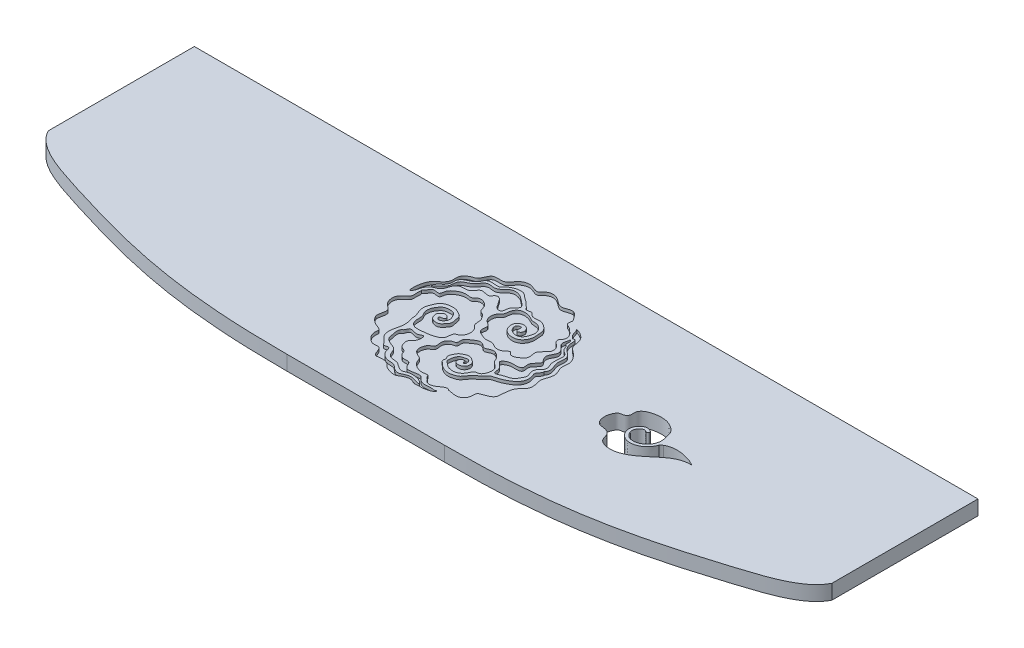
from build123d import *

# Parameters (mm, degrees)
BOSS_EXTRUDE1_DEPTH   = 1
BOSS_EXTRUDE1_2_DEPTH = 1
BOSS_EXTRUDE1_3_DEPTH = 1
BOSS_EXTRUDE3_DEPTH   = 1
SKETCH2_R             = 25.101353652
BOSS_EXTRUDE2_DEPTH   = 1
SKETCH3_W             = 253.62074887
SKETCH3_H             = 71.275896812
BOSS_EXTRUDE4_DEPTH   = 4.75
CUT_EXTRUDE1_DEPTH    = 2
CUT_EXTRUDE2_DEPTH    = 132.808561798
CUT_EXTRUDE3_DEPTH    = 132.808561802


with BuildPart() as part:
    # Sketch1 → Boss-Extrude1 (new body)
    with BuildSketch(Plane(origin=(0, 0, 0), x_dir=(1, 0, 0), z_dir=(0, 1, 0))):
        with BuildLine():
            add(Edge.make_bspline(
                [(-22.657700945, 3.566137127), (-22.563075027, 4.624031382), (-21.761621272, 6.480086653), (-19.815989286, 7.04802782), (-18.412013179, 8.060840455), (-18.29531858, 9.855374146), (-16.704778607, 11.884521762), (-14.192946372, 11.140079806), (-12.988988627, 12.691613103), (-11.8065693, 14.406327549), (-9.309951162, 12.767536509), (-8.561122509, 14.307301198), (-7.639842522, 14.929181339), (-6.425133548, 14.181513411), (-5.99792689, 13.167270669), (-5.292204197, 12.452981418), (-5.003762856, 11.581061251), (-4.160339051, 10.992247421), (-2.599217111, 10.853898339), (-2.823606313, 13.071768576), (-1.84164571, 14.159264117), (-0.300835314, 15.58788963), (-2.358409004, 17.013661093), (-3.54729972, 18.044647147), (-5.11043484, 18.949001762), (-7.005550972, 19.123672766), (-8.311690989, 17.879986895), (-9.139755488, 17.07338369), (-10.850341908, 16.222267664), (-12.506670955, 17.021641787), (-14.082140957, 15.901195549), (-14.784359861, 14.430733392), (-16.473643912, 13.491155241), (-18.562061532, 12.625798306), (-18.240140649, 10.004634904), (-19.468938662, 8.607227898), (-21.969060467, 6.217831732), (-20.994296139, 8.482915912), (-19.81088583, 9.14374692), (-18.776132731, 10.699338648), (-19.150743077, 12.510998979), (-17.845166223, 14.095108924), (-16.078653923, 14.50885238), (-14.747613409, 15.729966598), (-14.310991002, 17.163169976), (-12.414022297, 18.024659863), (-10.234521647, 17.008097584), (-9.161729716, 18.536943989), (-8.373009435, 19.137649982), (-6.811653992, 19.942084445), (-4.612028514, 20.2767563), (-3.050323675, 18.646525233), (-1.821328042, 18.099064143), (-0.845551247, 16.853170761), (0.042044696, 16.40929203), (0.70348453, 15.059368319), (2.324059981, 16.167814906), (3.003374848, 14.910993224), (4.397333383, 14.289763408), (6.042999933, 14.861325487), (8.035231966, 13.937576078), (9.428743803, 12.733786548), (9.566197549, 10.464653929), (9.875836049, 8.299336805), (8.1395515, 5.728763314), (5.21230047, 5.369849711), (2.549287028, 6.880502619), (2.17408454, 10.528779114), (5.696088557, 11.406539936), (6.920434176, 8.814218219), (5.378204065, 7.730338539), (4.618004305, 8.700777916), (5.333751824, 10.026074452), (3.134593539, 9.829991294), (3.650868201, 7.832662657), (4.817518295, 7.015231066), (6.108202813, 6.578080657), (7.680260791, 7.080394364), (8.577052135, 8.862612491), (8.997173262, 10.977740681), (7.819496543, 12.503191913), (6.436418932, 13.486571646), (4.757186283, 13.214678428), (2.758953629, 14.575591149), (-0.123430172, 14.950615786), (-1.752262645, 12.602476003), (-1.453371251, 10.732288423), (-2.595223322, 10.056532198), (-3.447235674, 8.691842845), (-3.324228936, 6.03602782), (-0.30551766, 4.974276746), (-1.43992813, 2.626109568), (-0.056000594, 1.528148997), (1.007248559, 1.140684978), (2.558560273, 0.422947732), (4.333309083, 1.126428553), (6.087211825, -0.201427316), (7.974887536, -0.281964419), (9.011637296, 0.737929227), (9.983521568, 1.548778893), (10.596020706, 0.043366015), (12.424849423, 0.40486745), (13.439834027, 1.384060559), (15.077699591, 2.658386996), (13.530297418, 5.128290278), (15.132677675, 6.171418448), (15.296363849, 7.093264368), (16.728568332, 7.65184914), (16.457226204, 10.45762267), (14.332911, 11.038747233), (14.188661429, 12.68077393), (15.372642439, 13.416147167), (15.160036258, 15.360572862), (13.747142112, 16.515758696), (12.684040371, 17.629731407), (11.000256524, 18.036480651), (11.225471084, 19.3904939), (11.41576675, 19.87092144)],
                knots=[0, 0, 0, 0, 0.017523663, 0.025959482, 0.030717232, 0.043241503, 0.051537727, 0.067078171, 0.074413601, 0.080526409, 0.096702774, 0.100460127, 0.105002245, 0.112222056, 0.118418387, 0.122182452, 0.127503544, 0.131914264, 0.137942063, 0.146241458, 0.157580756, 0.161522541, 0.175435486, 0.18221518, 0.188128997, 0.203154719, 0.206367109, 0.215675327, 0.221113579, 0.234901304, 0.238660912, 0.249814319, 0.258904826, 0.268447313, 0.281308595, 0.29111387, 0.303078437, 0.309290665, 0.31679302, 0.326136458, 0.335142849, 0.343491566, 0.354676175, 0.362589519, 0.370311266, 0.37643044, 0.39254918, 0.398874993, 0.402834307, 0.407904952, 0.426452265, 0.429989996, 0.442259466, 0.446574017, 0.454076462, 0.457325817, 0.467270799, 0.471161081, 0.476863036, 0.48964413, 0.495378404, 0.510439895, 0.514274139, 0.530155592, 0.543256486, 0.557251083, 0.571606522, 0.586907656, 0.600593405, 0.611983518, 0.617798518, 0.621373523, 0.627624131, 0.632962588, 0.642862605, 0.648297653, 0.655747682, 0.662921561, 0.671572105, 0.685355056, 0.693206634, 0.699985268, 0.71072487, 0.716803747, 0.737207518, 0.746134899, 0.757660823, 0.761539365, 0.765368912, 0.782390668, 0.793553782, 0.80456569, 0.811493813, 0.817543754, 0.82254674, 0.837450794, 0.841685931, 0.856013065, 0.860236066, 0.866012492, 0.86937196, 0.88046211, 0.886323346, 0.892551249, 0.909708122, 0.913831035, 0.919826721, 0.922281703, 0.936224996, 0.947414152, 0.95274072, 0.957126005, 0.96704293, 0.976477191, 0.985240841, 0.990903584, 1, 1, 1, 1], degree=3))
            add(Edge.make_bspline(
                [(-15.793989559, 16.808282214), (-15.21735742, 17.741847858), (-14.632636394, 20.457567565), (-10.314773434, 19.034010353), (-8.766307809, 22.640797342), (-5.389132618, 23.786571984), (-2.56862384, 21.701248487), (-1.085845307, 24.103979233), (1.439508916, 24.489742682), (3.402939972, 23.165746713), (5.594640629, 21.315193189), (8.749619612, 23.708591294), (10.529717069, 21.283035319), (11.268876231, 20.085990932), (11.41576675, 19.87092144)],
                knots=[0, 0, 0, 0, 0.019600588, 0.039791796, 0.060359563, 0.080527002, 0.098332478, 0.108628014, 0.124559506, 0.139100524, 0.151814102, 0.172323487, 0.191936306, 0.196615233, 0.196615233, 0.196615233, 0.196615233], degree=3))
            add(Edge.make_bspline(
                [(-22.657700945, 3.566137127), (-22.775935274, 3.312459937), (-23.017483387, 2.744953533), (-24.02184756, 1.011363184), (-23.998440315, 8.453426635), (-20.692978035, 9.212540033), (-19.365563401, 11.852676999), (-20.003375789, 14.247993746), (-17.847267571, 15.92855271), (-16.158523921, 16.25918734), (-15.846528818, 16.723221317), (-15.793989559, 16.808282214)],
                knots=[0.884410347, 0.884410347, 0.884410347, 0.884410347, 0.888045598, 0.891981775, 0.919321247, 0.948755615, 0.956912259, 0.970306583, 0.989857361, 0.998214112, 1, 1, 1, 1], degree=3))
        make_face()
    extrude(amount=BOSS_EXTRUDE1_DEPTH)



with BuildPart() as body_2:
    # Sketch1 → Boss-Extrude1 2 (new body)
    with BuildSketch(Plane(origin=(0, 0, 0), x_dir=(1, 0, 0), z_dir=(0, 1, 0))):
        with BuildLine():
            add(Edge.make_bspline(
                [(8.738206711, -21.480649685), (8.857147499, -21.591131322), (9.339681484, -22.03840584), (6.979869809, -23.171986321), (5.227134713, -23.108716482), (3.074067174, -23.379058444), (1.811708147, -22.561027368), (0.443712796, -22.618776816), (-0.838094029, -23.190549395), (-2.266992502, -24.261695821), (-4.038553217, -23.704245729), (-5.728478521, -23.251815646), (-6.496822526, -22.137437039), (-7.96274848, -21.480830158), (-9.357927187, -21.429344735), (-11.407386223, -21.931747594), (-11.700204954, -19.890405009), (-12.843307278, -18.38049181), (-14.454138466, -18.990607704), (-15.877593896, -18.172998354), (-17.141914233, -16.977741229), (-17.687428322, -15.423400146), (-17.29960853, -13.621267042), (-19.54179494, -13.019923748), (-20.967933097, -11.994166649), (-22.578780727, -9.828320225), (-20.735645276, -6.93875062), (-23.214462664, -5.696645174), (-24.393348329, -3.955286469), (-24.533978255, -0.864820477), (-21.290216635, 0.411692653), (-21.882953993, 2.662231807), (-21.558739193, 3.666990411), (-21.779435994, 4.14450209), (-21.809339542, 4.19639557)],
                knots=[0.539303907, 0.539303907, 0.539303907, 0.539303907, 0.542070785, 0.551795943, 0.569399582, 0.582773974, 0.587507567, 0.596329196, 0.606155001, 0.61337397, 0.627563569, 0.636827428, 0.644846207, 0.651043204, 0.665423873, 0.670738632, 0.685775262, 0.692554374, 0.702884067, 0.711644091, 0.721295181, 0.73444703, 0.74049368, 0.751123198, 0.767985532, 0.775078558, 0.798057308, 0.809390018, 0.818542453, 0.836855705, 0.856687953, 0.866982446, 0.874576744, 0.875636141, 0.875636141, 0.875636141, 0.875636141], degree=3))
            add(Edge.make_bspline(
                [(-21.809339542, 4.19639557), (-21.018528742, 4.520358028), (-20.619063549, 6.913524941), (-17.637948418, 5.468558069), (-17.721345385, 7.887545363), (-16.62796477, 8.931679832), (-15.071242611, 9.925937304), (-13.382871495, 10.417741315), (-11.568104496, 9.824584296), (-10.796709499, 10.890026258), (-9.500102559, 11.393807312), (-8.047395888, 10.782931062), (-6.847041594, 9.725898806), (-6.730280975, 8.412761), (-6.027101275, 7.414433173), (-5.000357739, 7.349244619), (-4.506058466, 6.44567987), (-3.667972512, 5.471941541), (-3.72332394, 4.169809555), (-3.437039957, 2.739670365), (-1.598941623, 1.528257064), (-1.769185912, -1.262527467), (-3.138939851, -2.528920595), (-4.62731434, -2.717637341), (-4.328252888, -4.580508609), (-4.932681342, -5.771311811), (-5.717134821, -6.326690659), (-7.31684022, -7.03566226), (-9.625500613, -7.214973105), (-12.057489942, -7.571207029), (-13.537699562, -6.838472258), (-14.540974819, -5.270745221), (-13.990238863, -3.286375659), (-15.388031719, -1.43939155), (-15.309773381, 0.387648937), (-14.449295722, 1.834134986), (-13.50833737, 3.02003233), (-11.812464114, 3.247793239), (-10.173705964, 3.116328765), (-9.404660697, 1.886455118), (-8.775572127, 0.644443686), (-9.257091101, -0.921842929), (-11.01008766, -1.932518889), (-11.609798381, -0.229071903), (-10.44502465, -0.507203458), (-9.501208233, 0.411577929), (-10.672479407, 1.239972144), (-11.607602658, 1.276674803), (-12.104806766, 0.751479388), (-12.796893955, 0.208597109), (-12.670192842, -0.913655901), (-12.285249681, -1.914033702), (-11.121701199, -2.62868487), (-9.533150062, -2.707907836), (-8.535215295, -1.486798857), (-7.415457546, -0.204584988), (-8.022671582, 1.451061492), (-8.237789449, 3.053852004), (-9.416499401, 3.690660513), (-10.996852338, 4.532474252), (-12.93114782, 4.432115955), (-14.569257238, 3.85603816), (-15.051017754, 3.162247249), (-15.67202115, 2.648515677), (-15.983026108, 1.57517172), (-16.606931699, 0.286844403), (-16.569937111, -1.382348619), (-16.057300811, -2.748808228), (-15.444348285, -4.019125272), (-15.542220911, -5.435676987), (-14.79767165, -7.147571138), (-14.895885261, -9.412612434), (-15.577059857, -11.475498969), (-15.574089145, -13.308170552), (-14.997888865, -15.348943016), (-13.318724327, -16.057976844), (-12.480318595, -17.766239051), (-10.860572921, -16.692246885), (-10.569567055, -18.372844107), (-10.157531243, -19.448308943), (-9.183951859, -20.277245952), (-7.698752165, -21.218761948), (-5.554266703, -20.753008535), (-4.164709187, -22.325831729), (-2.513440415, -23.178445261), (-0.894309149, -22.202151561), (0.933743642, -21.67627036), (2.256682954, -22.213111705), (4.670197896, -22.870414805), (3.279272969, -21.581843201), (1.708303511, -21.045614182), (-0.498418861, -20.776672543), (-2.43193344, -21.974838924), (-3.597952723, -21.258571842), (-4.439954282, -20.824498679), (-5.527059127, -19.772571015), (-7.174315599, -20.080648675), (-9.17771691, -19.006577061), (-9.247741331, -16.823486569), (-10.997619947, -16.182462955), (-12.253738065, -15.67818558), (-13.706046904, -14.912977433), (-13.967327288, -12.802757635), (-14.68486839, -10.736896304), (-13.285676504, -9.763154316), (-12.988324107, -7.696899699), (-10.484597456, -9.633929623), (-8.241222262, -7.702403382), (-8.216353808, -10.247442415), (-8.831486965, -11.282699029), (-10.097333449, -12.148285287), (-9.830327049, -13.901220976), (-9.001697973, -15.079016419), (-8.176809113, -15.361313512), (-7.27806108, -15.830800924), (-7.25666593, -16.871811539), (-6.535833259, -17.325156448), (-5.69701815, -18.340698523), (-3.618301033, -17.487620568), (-3.023354381, -19.27834964), (-1.541149592, -21.353259629), (1.730672334, -19.104204035), (3.172946387, -21.193877555), (5.011109917, -22.22492864), (6.91592853, -21.451539789), (8.676610353, -22.025567117), (8.738206711, -21.480649685)],
                knots=[0, 0, 0, 0, 0.014094678, 0.024402235, 0.032479858, 0.042170464, 0.047831524, 0.061476572, 0.069531445, 0.072837566, 0.080911898, 0.089326788, 0.096481371, 0.104874385, 0.109179701, 0.114476577, 0.119152154, 0.12439729, 0.134429704, 0.138438595, 0.146786852, 0.16661871, 0.170325032, 0.176000802, 0.186746984, 0.192634253, 0.196756808, 0.20155952, 0.220095701, 0.23306589, 0.239027782, 0.245035202, 0.26096485, 0.266924562, 0.280385244, 0.2861936, 0.293737692, 0.302936931, 0.312197964, 0.316955416, 0.324973781, 0.333138187, 0.341833816, 0.346330457, 0.350789722, 0.35514014, 0.362608031, 0.365746026, 0.36953239, 0.373364051, 0.378936435, 0.385377432, 0.389779023, 0.399868426, 0.406743286, 0.413900418, 0.425004668, 0.431780276, 0.438151291, 0.444552492, 0.460241896, 0.466798703, 0.470839627, 0.473243739, 0.479329745, 0.487694939, 0.495788419, 0.504643081, 0.510701229, 0.517632557, 0.526315273, 0.53953181, 0.552205032, 0.560313441, 0.568297128, 0.583826475, 0.586879998, 0.595112754, 0.601033805, 0.607384937, 0.614311957, 0.620352232, 0.634781905, 0.643496279, 0.652196434, 0.661125491, 0.671595101, 0.679597266, 0.68805743, 0.693646008, 0.699105022, 0.717127668, 0.725282613, 0.731423441, 0.736824252, 0.74056258, 0.754478613, 0.759788811, 0.774696294, 0.781386672, 0.787157554, 0.796852074, 0.804244837, 0.820266018, 0.823349667, 0.830089416, 0.845680109, 0.853134124, 0.863577361, 0.86945441, 0.873443549, 0.886469823, 0.890812673, 0.895778881, 0.899972123, 0.905690972, 0.909644263, 0.912783266, 0.925802483, 0.932459145, 0.939052149, 0.963394295, 0.967333005, 0.977320454, 0.993614915, 1, 1, 1, 1], degree=3))
        make_face()
    extrude(amount=BOSS_EXTRUDE1_2_DEPTH)


with BuildPart() as body_3:
    # Sketch1 → Boss-Extrude1 3 (new body)
    with BuildSketch(Plane(origin=(0, 0, 0), x_dir=(1, 0, 0), z_dir=(0, 1, 0))):
        with BuildLine():
            add(Edge.make_bspline(
                [(14.378542955, 18.224264211), (14.951778297, 17.491819451), (14.913017591, 16.054079897), (16.018628934, 15.228730739), (16.162200163, 14.954417401), (16.189801516, 14.884222392)],
                knots=[0, 0, 0, 0, 0.048007737, 0.060838027, 0.064997614, 0.064997614, 0.064997614, 0.064997614], degree=3))
            add(Edge.make_bspline(
                [(16.189801516, 14.884222392), (17.383288574, 15.393094222), (17.224057471, 13.605099567), (17.652348801, 11.77298829), (18.843159185, 10.57974598), (19.798917382, 9.806642822), (21.15671492, 8.431118737), (20.313466514, 6.318288792), (21.205317129, 3.762032763), (21.908353975, 2.26650214), (20.950539607, 1.09791609)],
                knots=[0, 0, 0, 0, 0.136094131, 0.257351293, 0.362129742, 0.437621231, 0.492185614, 0.708508782, 0.775442371, 1, 1, 1, 1], degree=3))
            add(Edge.make_bspline(
                [(20.950539607, 1.09791609), (21.121971745, 0.311242926), (19.52433718, -0.460423386), (20.347848353, -2.095908447), (20.587003195, -3.560529491), (20.092258817, -5.294776093), (18.821822383, -6.546026983), (17.523775035, -7.298638474), (16.174196545, -7.972076459), (14.880374908, -8.366518763), (13.413615198, -8.709416495), (12.345394981, -9.799440018), (11.441446145, -10.76430765), (10.302090963, -11.599844093), (9.447965932, -12.735450546), (8.609309748, -14.01030015), (7.184596664, -14.484153485), (5.686992394, -14.90213976), (4.140951779, -14.4850235), (2.790891837, -13.730599836), (2.11407037, -12.919263865), (1.112881215, -12.2331013), (1.642820506, -11.150327264), (0.680427484, -10.122628516), (1.355006486, -8.865861767), (1.905637521, -7.707322569), (3.082613369, -7.023356321), (4.539889009, -6.399298012), (5.898186187, -7.206617268), (7.013731771, -8.064311578), (7.120460682, -9.417462071), (6.429154813, -10.553294695), (5.174269692, -10.939261746), (3.613944604, -10.658316321), (3.657753647, -9.117430754), (4.418022863, -8.664303072), (5.402890948, -8.569441487), (5.042316411, -9.543257226), (6.206753067, -9.63492861), (5.889866064, -8.756714316), (5.880505212, -8.119467662), (5.067982729, -7.555791522), (4.064825892, -8.02746718), (2.893801634, -8.238360568), (2.374457022, -9.345905932), (2.113851605, -10.395030248), (2.036615323, -11.716180503), (3.11768482, -12.245206597), (3.781556023, -13.011799125), (5.150587385, -13.510401661), (6.848470052, -13.631038937), (8.32531324, -12.563867501), (9.055283848, -11.396540819), (9.491624919, -9.978794185), (11.130263511, -10.145506671), (12.253074969, -8.401322252), (12.557994713, -6.00493252), (10.885066866, -4.895178658), (9.890472814, -4.046393104), (9.627685611, -2.93188682), (8.881471335, -2.343729728), (8.085164683, -1.4048954), (6.298404353, -0.883419294), (4.64373839, -2.384179875), (3.455200821, -1.173574516), (2.183727012, -0.611797275), (0.958569569, -1.259712839), (0.095250202, -1.855294106), (-0.621209366, -2.409669545), (-1.551397562, -3.215568999), (-0.879681767, -5.123203399), (-2.630065922, -5.174365249), (-3.517353331, -5.979503816), (-4.275188999, -7.403519526), (-3.31446389, -9.444520594), (-5.173442607, -10.120413882), (-5.861440174, -11.53134727), (-5.998880766, -13.529036241), (-4.405765689, -14.718525748), (-2.856847385, -15.204789955), (-2.550000712, -16.670776269), (-1.438332446, -17.975469405), (0.306502121, -18.820184336), (1.803685389, -18.839629824), (3.174431982, -18.427657483), (3.386614587, -19.407583656), (4.245847772, -19.884002557), (5.033854676, -21.330169232), (7.571863978, -20.804766582), (8.857750493, -19.35534223), (10.325632507, -19.078309858), (10.617045526, -19.588546646)],
                knots=[0, 0, 0, 0, 0.019004137, 0.026343927, 0.041274963, 0.056237572, 0.06885451, 0.084688076, 0.09353579, 0.106291369, 0.118490959, 0.130048805, 0.143263409, 0.15163635, 0.164893975, 0.178749195, 0.187878446, 0.201351431, 0.216948749, 0.226154985, 0.239297215, 0.243937363, 0.253693407, 0.261861133, 0.274534081, 0.284048337, 0.293995175, 0.307595117, 0.320544991, 0.330713926, 0.34140515, 0.350863053, 0.3615253, 0.373182024, 0.382930523, 0.390663688, 0.39529469, 0.401283032, 0.406113231, 0.413540379, 0.416771339, 0.422411319, 0.433944786, 0.442494839, 0.450435566, 0.461741141, 0.47126012, 0.478837834, 0.489057821, 0.49636403, 0.514465823, 0.528937957, 0.538723927, 0.549645286, 0.560759792, 0.572162082, 0.597606157, 0.610050355, 0.619578243, 0.629586913, 0.636777622, 0.642589376, 0.660351923, 0.676316123, 0.685951277, 0.697677648, 0.708653084, 0.717959798, 0.724157401, 0.731391915, 0.747082276, 0.756777854, 0.766068104, 0.776583612, 0.79542531, 0.807093008, 0.817328048, 0.833816163, 0.851743534, 0.862443409, 0.871136062, 0.886070679, 0.90433184, 0.916318613, 0.925674701, 0.931839141, 0.936603242, 0.949690771, 0.968348716, 0.988103962, 1, 1, 1, 1], degree=3))
            add(Edge.make_bspline(
                [(14.378542955, 18.224264211), (14.568229226, 18.173407114), (16.133154712, 17.724015983), (18.474433781, 16.039573476), (18.233690779, 12.59287578), (20.977240574, 10.778789442), (23.140915259, 8.266796762), (22.146180082, 4.797415339), (23.941618085, 2.498972588), (23.297880201, 0.049649657), (22.546745966, -1.837255297), (23.201140292, -3.748301188), (23.474641549, -6.295459185), (21.228062141, -7.717089194), (20.538684651, -10.068574292), (20.406642804, -11.873529443), (20.266115955, -14.472310108), (17.956615226, -15.026083199), (15.846036659, -15.929390357), (16.217989655, -17.83359142), (15.198785761, -19.58866835), (12.974814279, -20.203542825), (11.460081863, -19.564384677), (10.617045526, -19.588546646)],
                knots=[0.218302479, 0.218302479, 0.218302479, 0.218302479, 0.221696599, 0.246260264, 0.264907817, 0.276181758, 0.304228006, 0.31740472, 0.337773307, 0.350741318, 0.361838931, 0.373794244, 0.386952746, 0.40469075, 0.416217145, 0.430422316, 0.438847583, 0.46058315, 0.466166688, 0.478122002, 0.489289079, 0.500898378, 0.517004032, 0.517004032, 0.517004032, 0.517004032], degree=3))
        make_face()
    extrude(amount=BOSS_EXTRUDE1_3_DEPTH)


with BuildPart() as body_4:
    # Sketch1<4> → Boss-Extrude3 (new body)
    with BuildSketch(Plane(origin=(0, 0, 0), x_dir=(1, 0, 0), z_dir=(0, 1, 0))):
        with BuildLine():
            add(Edge.make_bspline(
                [(16.26874568, 14.219083547), (16.210945771, 13.413927154), (15.346557496, 11.559644688), (17.462674364, 10.403105268), (18.279336275, 8.574242013), (17.376366292, 7.144172981), (16.764830688, 5.793375999), (17.262706535, 4.497380655), (18.56587191, 3.237834948), (16.881545559, 1.93924713), (16.036770807, 0.464014018), (16.863689136, -1.566729315), (14.392560319, -1.915516126), (12.803412474, -1.546454035), (10.41522969, -3.035246396), (11.967523099, -4.364726343), (13.065938825, -5.285461134), (13.012239351, -7.83814469), (15.144986593, -6.66116665), (16.555998989, -6.42963099), (18.193218834, -5.750906149), (18.863442773, -4.40136735), (19.784414494, -2.875682822), (18.702841176, -1.275828287), (18.930420443, 0.49857483), (20.19865782, 1.303567355), (20.714326896, 2.765502828), (19.296759197, 4.887570324), (20.031259936, 7.037940706), (19.726058395, 9.54171264), (17.757328952, 10.046550584), (17.581108157, 11.714049671), (16.263300644, 12.484188225), (17.230860156, 13.868894696), (16.30700671, 14.219083547)],
                knots=[0.076885675, 0.076885675, 0.076885675, 0.076885675, 0.116916326, 0.154167772, 0.181525858, 0.207721351, 0.235259572, 0.251655148, 0.276418182, 0.310412349, 0.332899475, 0.363832243, 0.390995188, 0.428358199, 0.464184822, 0.478417548, 0.516811679, 0.542949719, 0.569241193, 0.60430079, 0.626556007, 0.652604392, 0.679712672, 0.707973263, 0.741969869, 0.755255819, 0.782390816, 0.808864498, 0.875857786, 0.88727671, 0.931801461, 0.952134294, 0.964166041, 1, 1, 1, 1], degree=3))
            Line((16.30700671, 14.219083547), (16.26874568, 14.219083547))
        make_face()
    extrude(amount=BOSS_EXTRUDE3_DEPTH)


with BuildPart() as part_1:
    add(part.part)

    add(body_2.part)  # Boss-Extrude2 merges body 2

    add(body_3.part)  # Boss-Extrude2 merges body 3

    add(body_4.part)  # Boss-Extrude2 merges body 4
    # Sketch2 → Boss-Extrude2 (add)
    with BuildSketch(Plane.XZ):
        Circle(SKETCH2_R)
    extrude(amount=BOSS_EXTRUDE2_DEPTH)

    # Sketch3 → Boss-Extrude4 (add)
    with BuildSketch(Plane(origin=(0, 0, 0), x_dir=(1, 0, 0), z_dir=(0, 1, 0))):
        Rectangle(SKETCH3_W, SKETCH3_H)
    extrude(amount=-BOSS_EXTRUDE4_DEPTH)

    # Sketch4 → Cut-Extrude1 (cut)
    with BuildSketch(Plane(origin=(0, 1, 0), x_dir=(1, 0, 0), z_dir=(0, 1, 0))):
        with BuildLine():
            Line((16.30700671, 14.219083547), (16.26874568, 14.219083547))
            add(Edge.make_bspline(
                [(16.26874568, 14.219083547), (16.210945771, 13.413927154), (15.346557496, 11.559644688), (17.462674364, 10.403105268), (18.279336275, 8.574242013), (17.376366292, 7.144172981), (16.764830688, 5.793375999), (17.262706535, 4.497380655), (18.56587191, 3.237834948), (16.881545559, 1.93924713), (16.036770807, 0.464014018), (16.863689136, -1.566729315), (14.392560319, -1.915516126), (12.803412474, -1.546454035), (10.41522969, -3.035246396), (11.967523099, -4.364726343), (13.065938825, -5.285461134), (13.012239351, -7.83814469), (15.144986593, -6.66116665), (16.555998989, -6.42963099), (18.193218834, -5.750906149), (18.863442773, -4.40136735), (19.784414494, -2.875682822), (18.702841176, -1.275828287), (18.930420443, 0.49857483), (20.19865782, 1.303567355), (20.714326896, 2.765502828), (19.296759197, 4.887570324), (20.031259936, 7.037940706), (19.726058395, 9.54171264), (17.757328952, 10.046550584), (17.581108157, 11.714049671), (16.263300644, 12.484188225), (17.230860156, 13.868894696), (16.30700671, 14.219083547)],
                knots=[0.076885675, 0.076885675, 0.076885675, 0.076885675, 0.116916326, 0.154167772, 0.181525858, 0.207721351, 0.235259572, 0.251655148, 0.276418182, 0.310412349, 0.332899475, 0.363832243, 0.390995188, 0.428358199, 0.464184822, 0.478417548, 0.516811679, 0.542949719, 0.569241193, 0.60430079, 0.626556007, 0.652604392, 0.679712672, 0.707973263, 0.741969869, 0.755255819, 0.782390816, 0.808864498, 0.875857786, 0.88727671, 0.931801461, 0.952134294, 0.964166041, 1, 1, 1, 1], degree=3))
        make_face()
        with BuildLine():
            add(Edge.make_bspline(
                [(11.41576675, 19.87092144), (11.268876231, 20.085990932), (10.529717069, 21.283035319), (8.749619612, 23.708591294), (5.594640629, 21.315193189), (3.402939972, 23.165746713), (1.439508916, 24.489742682), (-1.085845307, 24.103979233), (-2.56862384, 21.701248487), (-5.389132618, 23.786571984), (-8.766307809, 22.640797342), (-10.314773434, 19.034010353), (-14.632636394, 20.457567565), (-15.243600171, 17.619964166), (-16.158523921, 16.25918734), (-17.847267571, 15.92855271), (-20.003375789, 14.247993746), (-19.365563401, 11.852676999), (-20.692978035, 9.212540033), (-23.998440315, 8.453426635), (-24.02184756, 1.011363184), (-23.017483388, 2.744953531), (-22.775935277, 3.312459931), (-22.657700949, 3.566137118)],
                knots=[0.884410347, 0.884410347, 0.884410347, 0.884410347, 0.889089273, 0.908702093, 0.929211478, 0.941925056, 0.956466073, 0.972397565, 0.982693102, 1.000498577, 1.020666017, 1.041233784, 1.061424992, 1.08102558, 1.082811468, 1.091168219, 1.110718997, 1.12411332, 1.132269965, 1.161704333, 1.189043805, 1.192979981, 1.196615233, 1.196615233, 1.196615233, 1.196615233], degree=3))
            add(Edge.make_bspline(
                [(-22.657700949, 3.566137118), (-22.563075027, 4.624031382), (-21.761621272, 6.480086653), (-19.815989286, 7.04802782), (-18.412013179, 8.060840455), (-18.29531858, 9.855374146), (-16.704778607, 11.884521762), (-14.192946372, 11.140079806), (-12.988988627, 12.691613103), (-11.8065693, 14.406327549), (-9.309951162, 12.767536509), (-8.561122509, 14.307301198), (-7.639842522, 14.929181339), (-6.425133548, 14.181513411), (-5.99792689, 13.167270669), (-5.292204197, 12.452981418), (-5.003762856, 11.581061251), (-4.160339051, 10.992247421), (-2.599217111, 10.853898339), (-2.823606313, 13.071768576), (-1.84164571, 14.159264117), (-0.300835314, 15.58788963), (-2.358409004, 17.013661093), (-3.54729972, 18.044647147), (-5.11043484, 18.949001762), (-7.005550972, 19.123672766), (-8.311690989, 17.879986895), (-9.139755488, 17.07338369), (-10.850341908, 16.222267664), (-12.506670955, 17.021641787), (-14.082140957, 15.901195549), (-14.784359861, 14.430733392), (-16.473643912, 13.491155241), (-18.562061532, 12.625798306), (-18.240140649, 10.004634904), (-19.468938662, 8.607227898), (-21.969060467, 6.217831732), (-20.994296139, 8.482915912), (-19.81088583, 9.14374692), (-18.776132731, 10.699338648), (-19.150743077, 12.510998979), (-17.845166223, 14.095108924), (-16.078653923, 14.50885238), (-14.747613409, 15.729966598), (-14.310991002, 17.163169976), (-12.414022297, 18.024659863), (-10.234521647, 17.008097584), (-9.161729716, 18.536943989), (-8.373009435, 19.137649982), (-6.811653992, 19.942084445), (-4.612028514, 20.2767563), (-3.050323675, 18.646525233), (-1.821328042, 18.099064143), (-0.845551247, 16.853170761), (0.042044696, 16.40929203), (0.70348453, 15.059368319), (2.324059981, 16.167814906), (3.003374848, 14.910993224), (4.397333383, 14.289763408), (6.042999933, 14.861325487), (8.035231966, 13.937576078), (9.428743803, 12.733786548), (9.566197549, 10.464653929), (9.875836049, 8.299336805), (8.1395515, 5.728763314), (5.21230047, 5.369849711), (2.549287028, 6.880502619), (2.17408454, 10.528779114), (5.696088557, 11.406539936), (6.920434176, 8.814218219), (5.378204065, 7.730338539), (4.618004305, 8.700777916), (5.333751824, 10.026074452), (3.134593539, 9.829991294), (3.650868201, 7.832662657), (4.817518295, 7.015231066), (6.108202813, 6.578080657), (7.680260791, 7.080394364), (8.577052135, 8.862612491), (8.997173262, 10.977740681), (7.819496543, 12.503191913), (6.436418932, 13.486571646), (4.757186283, 13.214678428), (2.758953629, 14.575591149), (-0.123430172, 14.950615786), (-1.752262645, 12.602476003), (-1.453371251, 10.732288423), (-2.595223322, 10.056532198), (-3.447235674, 8.691842845), (-3.324228936, 6.03602782), (-0.30551766, 4.974276746), (-1.43992813, 2.626109568), (-0.056000594, 1.528148997), (1.007248559, 1.140684978), (2.558560273, 0.422947732), (4.333309083, 1.126428553), (6.087211825, -0.201427316), (7.974887536, -0.281964419), (9.011637296, 0.737929227), (9.983521568, 1.548778893), (10.596020706, 0.043366015), (12.424849423, 0.40486745), (13.439834027, 1.384060559), (15.077699591, 2.658386996), (13.530297418, 5.128290278), (15.132677675, 6.171418448), (15.296363849, 7.093264368), (16.728568332, 7.65184914), (16.457226204, 10.45762267), (14.332911, 11.038747233), (14.188661429, 12.68077393), (15.372642439, 13.416147167), (15.160036258, 15.360572862), (13.747142112, 16.515758696), (12.684040371, 17.629731407), (11.000256524, 18.036480651), (11.225471084, 19.3904939), (11.41576675, 19.87092144)],
                knots=[0, 0, 0, 0, 0.017523663, 0.025959482, 0.030717232, 0.043241503, 0.051537727, 0.067078171, 0.074413601, 0.080526409, 0.096702774, 0.100460127, 0.105002245, 0.112222056, 0.118418387, 0.122182452, 0.127503544, 0.131914264, 0.137942063, 0.146241458, 0.157580756, 0.161522541, 0.175435486, 0.18221518, 0.188128997, 0.203154719, 0.206367109, 0.215675327, 0.221113579, 0.234901304, 0.238660912, 0.249814319, 0.258904826, 0.268447313, 0.281308595, 0.29111387, 0.303078437, 0.309290665, 0.31679302, 0.326136458, 0.335142849, 0.343491566, 0.354676175, 0.362589519, 0.370311266, 0.37643044, 0.39254918, 0.398874993, 0.402834307, 0.407904952, 0.426452265, 0.429989996, 0.442259466, 0.446574017, 0.454076462, 0.457325817, 0.467270799, 0.471161081, 0.476863036, 0.48964413, 0.495378404, 0.510439895, 0.514274139, 0.530155592, 0.543256486, 0.557251083, 0.571606522, 0.586907656, 0.600593405, 0.611983518, 0.617798518, 0.621373523, 0.627624131, 0.632962588, 0.642862605, 0.648297653, 0.655747682, 0.662921561, 0.671572105, 0.685355056, 0.693206634, 0.699985268, 0.71072487, 0.716803747, 0.737207518, 0.746134899, 0.757660823, 0.761539365, 0.765368912, 0.782390668, 0.793553782, 0.80456569, 0.811493813, 0.817543754, 0.82254674, 0.837450794, 0.841685931, 0.856013065, 0.860236066, 0.866012492, 0.86937196, 0.88046211, 0.886323346, 0.892551249, 0.909708122, 0.913831035, 0.919826721, 0.922281703, 0.936224996, 0.947414152, 0.95274072, 0.957126005, 0.96704293, 0.976477191, 0.985240841, 0.990903584, 1, 1, 1, 1], degree=3))
        make_face()
        with BuildLine():
            add(Edge.make_bspline(
                [(8.738206711, -21.480649685), (8.676610353, -22.025567117), (6.91592853, -21.451539789), (5.011109917, -22.22492864), (3.172946387, -21.193877555), (1.730672334, -19.104204035), (-1.541149592, -21.353259629), (-3.023354381, -19.27834964), (-3.618301033, -17.487620568), (-5.69701815, -18.340698523), (-6.535833259, -17.325156448), (-7.25666593, -16.871811539), (-7.27806108, -15.830800924), (-8.176809113, -15.361313512), (-9.001697973, -15.079016419), (-9.830327049, -13.901220976), (-10.097333449, -12.148285287), (-8.831486965, -11.282699029), (-8.216353808, -10.247442415), (-8.241222262, -7.702403382), (-10.484597456, -9.633929623), (-12.988324107, -7.696899699), (-13.285676504, -9.763154316), (-14.68486839, -10.736896304), (-13.967327288, -12.802757635), (-13.706046904, -14.912977433), (-12.253738065, -15.67818558), (-10.997619947, -16.182462955), (-9.247741331, -16.823486569), (-9.17771691, -19.006577061), (-7.174315599, -20.080648675), (-5.527059127, -19.772571015), (-4.439954282, -20.824498679), (-3.597952723, -21.258571842), (-2.43193344, -21.974838924), (-0.498418861, -20.776672543), (1.708303511, -21.045614182), (3.279272969, -21.581843201), (4.670197896, -22.870414805), (2.256682954, -22.213111705), (0.933743642, -21.67627036), (-0.894309149, -22.202151561), (-2.513440415, -23.178445261), (-4.164709187, -22.325831729), (-5.554266703, -20.753008535), (-7.698752165, -21.218761948), (-9.183951859, -20.277245952), (-10.157531243, -19.448308943), (-10.569567055, -18.372844107), (-10.860572921, -16.692246885), (-12.480318595, -17.766239051), (-13.318724327, -16.057976844), (-14.997888865, -15.348943016), (-15.574089145, -13.308170552), (-15.577059857, -11.475498969), (-14.895885261, -9.412612434), (-14.79767165, -7.147571138), (-15.542220911, -5.435676987), (-15.444348285, -4.019125272), (-16.057300811, -2.748808228), (-16.569937111, -1.382348619), (-16.606931699, 0.286844403), (-15.983026108, 1.57517172), (-15.67202115, 2.648515677), (-15.051017754, 3.162247249), (-14.569257238, 3.85603816), (-12.93114782, 4.432115955), (-10.996852338, 4.532474252), (-9.416499401, 3.690660513), (-8.237789449, 3.053852004), (-8.022671582, 1.451061492), (-7.415457546, -0.204584988), (-8.535215295, -1.486798857), (-9.533150062, -2.707907836), (-11.121701199, -2.62868487), (-12.285249681, -1.914033702), (-12.670192842, -0.913655901), (-12.796893955, 0.208597109), (-12.104806766, 0.751479388), (-11.607602658, 1.276674803), (-10.672479407, 1.239972144), (-9.501208233, 0.411577929), (-10.44502465, -0.507203458), (-11.609798381, -0.229071903), (-11.01008766, -1.932518889), (-9.257091101, -0.921842929), (-8.775572127, 0.644443686), (-9.404660697, 1.886455118), (-10.173705964, 3.116328765), (-11.812464114, 3.247793239), (-13.50833737, 3.02003233), (-14.449295722, 1.834134986), (-15.309773381, 0.387648937), (-15.388031719, -1.43939155), (-13.990238863, -3.286375659), (-14.540974819, -5.270745221), (-13.537699562, -6.838472258), (-12.057489942, -7.571207029), (-9.625500613, -7.214973105), (-7.31684022, -7.03566226), (-5.717134821, -6.326690659), (-4.932681342, -5.771311811), (-4.328252888, -4.580508609), (-4.62731434, -2.717637341), (-3.138939851, -2.528920595), (-1.769185912, -1.262527467), (-1.598941623, 1.528257064), (-3.437039957, 2.739670365), (-3.72332394, 4.169809555), (-3.667972512, 5.471941541), (-4.506058466, 6.44567987), (-5.000357739, 7.349244619), (-6.027101275, 7.414433173), (-6.730280975, 8.412761), (-6.847041594, 9.725898806), (-8.047395888, 10.782931062), (-9.500102559, 11.393807312), (-10.796709499, 10.890026258), (-11.568104496, 9.824584296), (-13.382871495, 10.417741315), (-15.071242611, 9.925937304), (-16.62796477, 8.931679832), (-17.721345385, 7.887545363), (-17.637948418, 5.468558069), (-20.619063549, 6.913524941), (-21.018528742, 4.520358028), (-21.809339542, 4.19639557)],
                knots=[0, 0, 0, 0, 0.006385085, 0.022679546, 0.032666995, 0.036605705, 0.060947851, 0.067540855, 0.074197517, 0.087216734, 0.090355737, 0.094309028, 0.100027877, 0.104221119, 0.109187327, 0.113530177, 0.126556451, 0.13054559, 0.136422639, 0.146865876, 0.154319891, 0.169910584, 0.176650333, 0.179733982, 0.195755163, 0.203147926, 0.212842446, 0.218613328, 0.225303706, 0.240211189, 0.245521387, 0.25943742, 0.263175748, 0.268576559, 0.274717387, 0.282872332, 0.300894978, 0.306353992, 0.31194257, 0.320402734, 0.328404899, 0.338874509, 0.347803566, 0.356503721, 0.365218095, 0.379647768, 0.385688043, 0.392615063, 0.398966195, 0.404887246, 0.413120002, 0.416173525, 0.431702872, 0.439686559, 0.447794968, 0.46046819, 0.473684727, 0.482367443, 0.489298771, 0.495356919, 0.504211581, 0.512305061, 0.520670255, 0.526756261, 0.529160373, 0.533201297, 0.539758104, 0.555447508, 0.561848709, 0.568219724, 0.574995332, 0.586099582, 0.593256714, 0.600131574, 0.610220977, 0.614622568, 0.621063565, 0.626635949, 0.63046761, 0.634253974, 0.637391969, 0.64485986, 0.649210278, 0.653669543, 0.658166184, 0.666861813, 0.675026219, 0.683044584, 0.687802036, 0.697063069, 0.706262308, 0.7138064, 0.719614756, 0.733075438, 0.73903515, 0.754964798, 0.760972218, 0.76693411, 0.779904299, 0.79844048, 0.803243192, 0.807365747, 0.813253016, 0.823999198, 0.829674968, 0.83338129, 0.853213148, 0.861561405, 0.865570296, 0.87560271, 0.880847846, 0.885523423, 0.890820299, 0.895125615, 0.903518629, 0.910673212, 0.919088102, 0.927162434, 0.930468555, 0.938523428, 0.952168476, 0.957829536, 0.967520142, 0.975597765, 0.985905322, 1, 1, 1, 1], degree=3))
            add(Edge.make_bspline(
                [(-21.809339542, 4.19639557), (-21.779435994, 4.144502092), (-21.558739193, 3.666990412), (-21.882953993, 2.662231807), (-21.290216635, 0.411692653), (-24.533978255, -0.864820477), (-24.393348329, -3.955286469), (-23.214462664, -5.696645174), (-20.735645276, -6.93875062), (-22.578780727, -9.828320225), (-20.967933097, -11.994166649), (-19.54179494, -13.019923748), (-17.29960853, -13.621267042), (-17.687428322, -15.423400146), (-17.141914233, -16.977741229), (-15.877593896, -18.172998354), (-14.454138466, -18.990607704), (-12.843307278, -18.38049181), (-11.700204954, -19.890405009), (-11.407386223, -21.931747594), (-9.357927187, -21.429344735), (-7.96274848, -21.480830158), (-6.496822526, -22.137437039), (-5.728478521, -23.251815646), (-4.038553217, -23.704245729), (-2.266992502, -24.261695821), (-0.838094029, -23.190549395), (0.443712796, -22.618776816), (1.811708147, -22.561027368), (3.074067174, -23.379058444), (5.227134713, -23.108716482), (6.979869809, -23.171986321), (9.339681484, -22.03840584), (8.857147499, -21.591131322), (8.738206711, -21.480649685)],
                knots=[0.539303907, 0.539303907, 0.539303907, 0.539303907, 0.540363304, 0.547957602, 0.558252095, 0.578084343, 0.596397595, 0.605550029, 0.61688274, 0.639861489, 0.646954516, 0.66381685, 0.674446368, 0.680493018, 0.693644866, 0.703295956, 0.712055981, 0.722385674, 0.729164786, 0.744201416, 0.749516175, 0.763896844, 0.770093841, 0.77811262, 0.787376478, 0.801566078, 0.808785047, 0.818610852, 0.827432481, 0.832166074, 0.845540466, 0.863144105, 0.872869263, 0.875636141, 0.875636141, 0.875636141, 0.875636141], degree=3))
        make_face()
        with BuildLine():
            add(Edge.make_bspline(
                [(16.189801516, 14.884222392), (17.383288574, 15.393094222), (17.224057471, 13.605099567), (17.652348801, 11.77298829), (18.843159185, 10.57974598), (19.798917382, 9.806642822), (21.15671492, 8.431118737), (20.313466514, 6.318288792), (21.205317129, 3.762032763), (21.908353975, 2.26650214), (20.950539607, 1.09791609)],
                knots=[0, 0, 0, 0, 0.136094131, 0.257351293, 0.362129742, 0.437621231, 0.492185614, 0.708508782, 0.775442371, 1, 1, 1, 1], degree=3))
            add(Edge.make_bspline(
                [(20.950539607, 1.09791609), (21.121971745, 0.311242926), (19.52433718, -0.460423386), (20.347848353, -2.095908447), (20.587003195, -3.560529491), (20.092258817, -5.294776093), (18.821822383, -6.546026983), (17.523775035, -7.298638474), (16.174196545, -7.972076459), (14.880374908, -8.366518763), (13.413615198, -8.709416495), (12.345394981, -9.799440018), (11.441446145, -10.76430765), (10.302090963, -11.599844093), (9.447965932, -12.735450546), (8.609309748, -14.01030015), (7.184596664, -14.484153485), (5.686992394, -14.90213976), (4.140951779, -14.4850235), (2.790891837, -13.730599836), (2.11407037, -12.919263865), (1.112881215, -12.2331013), (1.642820506, -11.150327264), (0.680427484, -10.122628516), (1.355006486, -8.865861767), (1.905637521, -7.707322569), (3.082613369, -7.023356321), (4.539889009, -6.399298012), (5.898186187, -7.206617268), (7.013731771, -8.064311578), (7.120460682, -9.417462071), (6.429154813, -10.553294695), (5.174269692, -10.939261746), (3.613944604, -10.658316321), (3.657753647, -9.117430754), (4.418022863, -8.664303072), (5.402890948, -8.569441487), (5.042316411, -9.543257226), (6.206753067, -9.63492861), (5.889866064, -8.756714316), (5.880505212, -8.119467662), (5.067982729, -7.555791522), (4.064825892, -8.02746718), (2.893801634, -8.238360568), (2.374457022, -9.345905932), (2.113851605, -10.395030248), (2.036615323, -11.716180503), (3.11768482, -12.245206597), (3.781556023, -13.011799125), (5.150587385, -13.510401661), (6.848470052, -13.631038937), (8.32531324, -12.563867501), (9.055283848, -11.396540819), (9.491624919, -9.978794185), (11.130263511, -10.145506671), (12.253074969, -8.401322252), (12.557994713, -6.00493252), (10.885066866, -4.895178658), (9.890472814, -4.046393104), (9.627685611, -2.93188682), (8.881471335, -2.343729728), (8.085164683, -1.4048954), (6.298404353, -0.883419294), (4.64373839, -2.384179875), (3.455200821, -1.173574516), (2.183727012, -0.611797275), (0.958569569, -1.259712839), (0.095250202, -1.855294106), (-0.621209366, -2.409669545), (-1.551397562, -3.215568999), (-0.879681767, -5.123203399), (-2.630065922, -5.174365249), (-3.517353331, -5.979503816), (-4.275188999, -7.403519526), (-3.31446389, -9.444520594), (-5.173442607, -10.120413882), (-5.861440174, -11.53134727), (-5.998880766, -13.529036241), (-4.405765689, -14.718525748), (-2.856847385, -15.204789955), (-2.550000712, -16.670776269), (-1.438332446, -17.975469405), (0.306502121, -18.820184336), (1.803685389, -18.839629824), (3.174431982, -18.427657483), (3.386614587, -19.407583656), (4.245847772, -19.884002557), (5.033854676, -21.330169232), (7.571863978, -20.804766582), (8.857750493, -19.35534223), (10.325632507, -19.078309858), (10.617045526, -19.588546646)],
                knots=[0, 0, 0, 0, 0.019004137, 0.026343927, 0.041274963, 0.056237572, 0.06885451, 0.084688076, 0.09353579, 0.106291369, 0.118490959, 0.130048805, 0.143263409, 0.15163635, 0.164893975, 0.178749195, 0.187878446, 0.201351431, 0.216948749, 0.226154985, 0.239297215, 0.243937363, 0.253693407, 0.261861133, 0.274534081, 0.284048337, 0.293995175, 0.307595117, 0.320544991, 0.330713926, 0.34140515, 0.350863053, 0.3615253, 0.373182024, 0.382930523, 0.390663688, 0.39529469, 0.401283032, 0.406113231, 0.413540379, 0.416771339, 0.422411319, 0.433944786, 0.442494839, 0.450435566, 0.461741141, 0.47126012, 0.478837834, 0.489057821, 0.49636403, 0.514465823, 0.528937957, 0.538723927, 0.549645286, 0.560759792, 0.572162082, 0.597606157, 0.610050355, 0.619578243, 0.629586913, 0.636777622, 0.642589376, 0.660351923, 0.676316123, 0.685951277, 0.697677648, 0.708653084, 0.717959798, 0.724157401, 0.731391915, 0.747082276, 0.756777854, 0.766068104, 0.776583612, 0.79542531, 0.807093008, 0.817328048, 0.833816163, 0.851743534, 0.862443409, 0.871136062, 0.886070679, 0.90433184, 0.916318613, 0.925674701, 0.931839141, 0.936603242, 0.949690771, 0.968348716, 0.988103962, 1, 1, 1, 1], degree=3))
            add(Edge.make_bspline(
                [(10.617045526, -19.588546646), (11.460081863, -19.564384677), (12.974814279, -20.203542825), (15.198785761, -19.58866835), (16.217989655, -17.83359142), (15.846036659, -15.929390357), (17.956615226, -15.026083199), (20.266115955, -14.472310108), (20.406642804, -11.873529443), (20.538684651, -10.068574292), (21.228062141, -7.717089194), (23.474641549, -6.295459185), (23.201140292, -3.748301188), (22.546745966, -1.837255297), (23.297880201, 0.049649657), (23.941618085, 2.498972588), (22.146180082, 4.797415339), (23.140915259, 8.266796762), (20.977240574, 10.778789442), (18.233690779, 12.59287578), (18.474433781, 16.039573476), (16.133154712, 17.724015983), (14.568229226, 18.173407114), (14.378542955, 18.224264211)],
                knots=[0.218302479, 0.218302479, 0.218302479, 0.218302479, 0.234408133, 0.246017432, 0.257184509, 0.269139823, 0.274723361, 0.296458927, 0.304884195, 0.319089366, 0.33061576, 0.348353765, 0.361512267, 0.37346758, 0.384565193, 0.397533204, 0.417901791, 0.431078505, 0.459124753, 0.470398694, 0.489046247, 0.513609912, 0.517004032, 0.517004032, 0.517004032, 0.517004032], degree=3))
            add(Edge.make_bspline(
                [(14.378542955, 18.224264211), (14.951778297, 17.491819451), (14.913017591, 16.054079897), (16.018628934, 15.228730739), (16.162200163, 14.954417401), (16.189801516, 14.884222392)],
                knots=[0, 0, 0, 0, 0.048007737, 0.060838027, 0.064997614, 0.064997614, 0.064997614, 0.064997614], degree=3))
        make_face()
    extrude(amount=-CUT_EXTRUDE1_DEPTH, mode=Mode.SUBTRACT)

    # Sketch5 → Cut-Extrude2 (cut, through all)
    with BuildSketch(Plane(origin=(0, 0, 0), x_dir=(1, 0, 0), z_dir=(0, 1, 0))):
        with BuildLine():
            Line((-126.810374435, -35.637948406), (-25.491634948, -35.637948406))
            add(Edge.make_bspline(
                [(-126.810374435, -11.630072824), (-123.970446812, -17.244962021), (-83.835427254, -30.88705395), (-59.525832596, -35.637948406), (-25.491634948, -35.637948406)],
                knots=[0.085023277, 0.085023277, 0.085023277, 0.085023277, 0.269806116, 1, 1, 1, 1], degree=3))
            Line((-126.810374435, -11.630072824), (-126.810374435, -35.637948406))
        make_face()
    cut_extrude2 = extrude(amount=-CUT_EXTRUDE2_DEPTH, mode=Mode.SUBTRACT)

    # Mirror1: Cut-Extrude2 across plane
    add(cut_extrude2.mirror(Plane(origin=(0, 0, 0), x_dir=(0, 0, 1), z_dir=(1, 0, 0))), mode=Mode.SUBTRACT)

    # Sketch6 → Cut-Extrude3 (cut, through all)
    with BuildSketch(Plane(origin=(0, 0, 0), x_dir=(1, 0, 0), z_dir=(0, 1, 0))):
        with BuildLine():
            add(Edge.make_bspline(
                [(60.840354815, -0.256513729), (61.215599964, -0.037671564), (62.024129175, 0.326217338), (63.666199462, 0.697110978), (65.874920347, 0.627116924), (68.217235442, 0.066208438), (69.920685793, -0.584832723), (70.66143719, -0.997118527), (71.016292319, -1.239672762)],
                knots=[0, 0, 0, 0, 0.096761715, 0.19352343, 0.387046861, 0.580570291, 0.677332006, 0.774093721, 0.774093721, 0.774093721, 0.774093721], degree=3))
            add(Edge.make_bspline(
                [(60.840354815, -0.256513729), (60.403161769, -0.511483774), (60.084072519, -0.929289339)],
                knots=[0, 0, 0, 1, 1, 1], degree=2))
            add(Edge.make_bspline(
                [(60.084072519, -0.929289339), (59.692666641, -2.126065931), (57.721625652, -4.772976899), (52.667531079, -5.511913663), (49.293635962, -0.528572588), (52.775876472, 2.938260049), (54.757695526, 1.61334285)],
                knots=[0.78488805, 0.78488805, 0.78488805, 0.78488805, 0.827943303, 0.887941984, 0.932965506, 1, 1, 1, 1], degree=3))
            ThreePointArc((54.757695526, 1.61334285), (54.895473943, 0.919788881), (54.201919974, 0.782010463))
            add(Edge.make_bspline(
                [(71.016292319, -1.239672762), (70.514121471, -1.202947483), (69.480640665, -1.228217342), (67.617633615, -1.640936309), (65.550040761, -2.681197193), (63.399945174, -4.348338573), (61.408181281, -6.082947749), (59.429175514, -7.650087392), (57.356248938, -8.947742826), (55.16925961, -9.80253749), (53.14306948, -9.996080484), (51.470016005, -9.738198198), (50.395677386, -9.325325193), (49.753643958, -8.823776427), (49.407430604, -8.34570238), (49.21849517, -7.907303964), (49.019974374, -7.251575539), (48.799902731, -6.627298266), (48.49872156, -6.100159601), (48.026684678, -5.569182806), (47.305281555, -5.203110836), (46.516034148, -5.029685039), (45.788376951, -4.936537565), (45.151940403, -4.839330597), (44.706712273, -4.704432267), (44.3882382, -4.504432461), (43.965085142, -4.083260418), (43.53825356, -3.289563091), (43.285426694, -2.168350272), (43.30333577, -1.108484061), (43.518594641, -0.21969166), (43.812736516, 0.509291249), (44.070222109, 0.982153375), (44.359156533, 1.337136387), (44.607905381, 1.523021452), (44.833761197, 1.622467372), (45.018413928, 1.67190195), (45.362520479, 1.722334817), (45.795733771, 1.795492941), (46.267952966, 1.945062255), (46.711451254, 2.301474688), (46.952439729, 2.702955651), (47.04122275, 3.04299679), (47.08132764, 3.424076568), (47.051820173, 3.95666763), (47.032832434, 4.379175323), (47.127462209, 4.819135366), (47.304162937, 5.211173708), (47.575456332, 5.582040758), (47.945457773, 5.932843105), (48.565284985, 6.364076056), (49.547367806, 6.811037564), (50.914056077, 7.159084015), (52.323395163, 7.31172627), (54.017333255, 7.266487984), (55.732025952, 6.79751774), (57.490914685, 5.703281983), (58.395481689, 4.626244978), (58.779409099, 3.722342969), (59.048999397, 2.488313296), (59.324152079, 1.214329884), (59.365042359, 0.22960595), (59.10964622, -0.819914559), (58.587850813, -1.823491457), (57.834044016, -2.705468045), (56.901743471, -3.383732697), (55.819278926, -3.823548117), (54.704355292, -3.979899537), (53.669643726, -3.834859622), (52.789105359, -3.390529966), (52.04254961, -2.609606996), (51.629809552, -1.673668757), (51.617604748, -0.780859966), (52.030752534, 0.190094238), (52.618356487, 0.765954194), (53.098704042, 0.990581936), (53.439083933, 1.04840316), (53.7282674, 1.010245837), (53.983013702, 0.913776145), (54.133853787, 0.827515154), (54.201919974, 0.782010463)],
                knots=[0.029695935, 0.029695935, 0.029695935, 0.029695935, 0.044856936, 0.060017937, 0.090339939, 0.120661941, 0.150983943, 0.181305945, 0.211627947, 0.241949949, 0.272271951, 0.287432952, 0.302593953, 0.317754954, 0.325335455, 0.332915955, 0.340496456, 0.348076956, 0.351867207, 0.355657457, 0.363237957, 0.370818458, 0.378398958, 0.385979459, 0.393559959, 0.40114046, 0.40872096, 0.423881961, 0.439042962, 0.454203963, 0.469364964, 0.476945465, 0.484525965, 0.492106466, 0.499686966, 0.503477217, 0.507267467, 0.511057717, 0.514847968, 0.518638218, 0.520533343, 0.522428468, 0.524323593, 0.526218718, 0.530008969, 0.537589469, 0.54516997, 0.55275047, 0.560330971, 0.567911471, 0.575491972, 0.590652973, 0.605813974, 0.620974975, 0.636135976, 0.666457978, 0.69677998, 0.711940981, 0.727101982, 0.742262983, 0.757423984, 0.772584985, 0.787745986, 0.802906987, 0.818067988, 0.833228989, 0.84838999, 0.863550991, 0.878711992, 0.893872993, 0.909033994, 0.924194995, 0.939355996, 0.954516997, 0.969677998, 0.977258498, 0.984838999, 0.992419499, 0.99620975, 1, 1, 1, 1], degree=3))
        make_face()
    extrude(amount=-CUT_EXTRUDE3_DEPTH, mode=Mode.SUBTRACT)


solid = part_1.part
